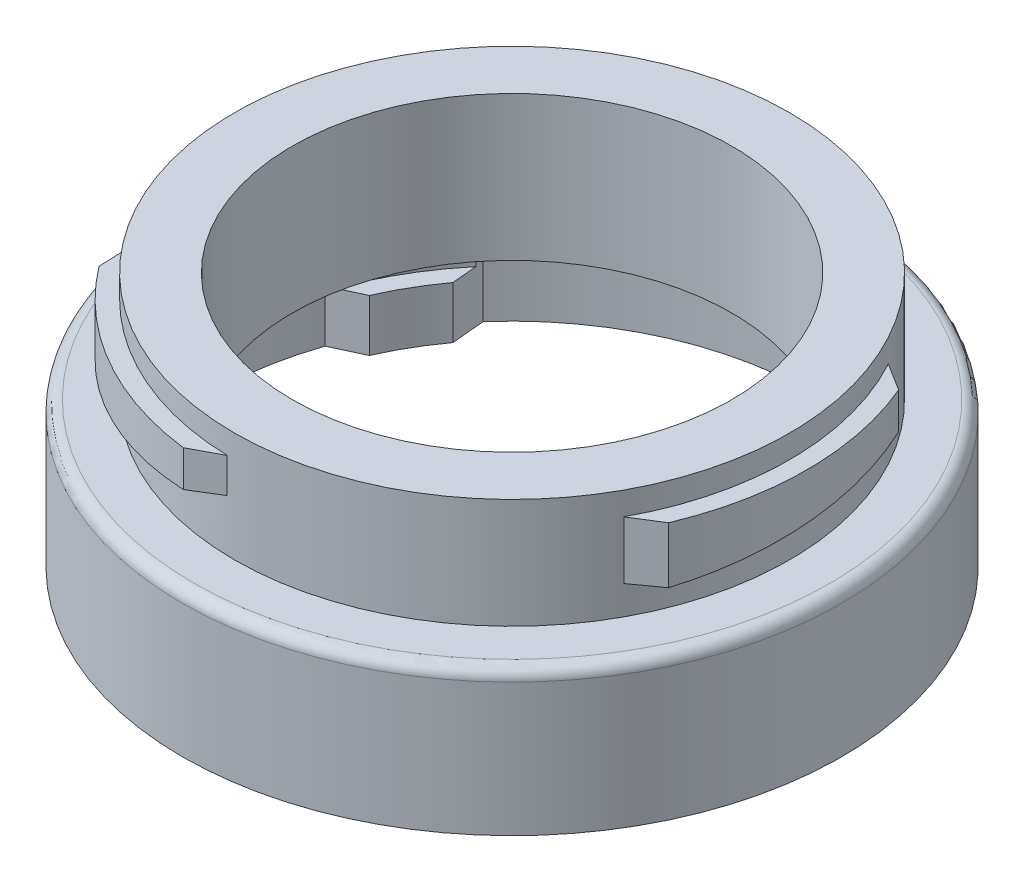
from build123d import *

# Parameters (mm, degrees)
CUT_EXTRUDE_1_DEPTH      = 5
EXTRUDE_1_DEPTH          = 6
PATTERN_CIRCULAR_1_COUNT = 3
SKETCH_4_R               = 42.404307435
SKETCH_4_R_2             = 25.5
CUT_EXTRUDE_2_DEPTH      = 9.5
CHAMFER_START            = 14
CHAMFER_1_DEPTH          = 6


with BuildPart() as part:
    # Эскиз1 → Повернуть1 (revolve)
    with BuildSketch(Plane.XY, mode=Mode.PRIVATE) as revolve_1_sk:
        with BuildLine():
            Line((-24, 0), (-24, 4.5))
            Line((-24, 4.5), (-25.5, 4.5))
            Line((-25.5, 4.5), (-25.5, 9.5))
            Line((-25.5, 9.5), (-19, 9.5))
            Line((-19, 9.5), (-19, 22))
            Line((-19, 22), (-24, 22))
            Line((-24, 22), (-24, 12.5))
            Line((-24, 12.5), (-27.5, 12.5))
            ThreePointArc((-27.5, 12.5), (-28.207106781, 12.207106781), (-28.5, 11.5))
            Line((-28.5, 11.5), (-28.5, 0))
            Line((-28.5, 0), (-24, 0))
        make_face()
    revolve(revolve_1_sk.sketch.rotate(Axis((0, 0, 0), (0, -1, 0)), 270), axis=Axis((0, 0, 0), (0, -1, 0)))

    # Эскиз2 → Вырез-Вытянуть1 (cut)
    with BuildSketch(Plane(origin=(0, 0, 0), x_dir=(-1, 0, 0), z_dir=(0, -1, 0))):
        with BuildLine():
            ThreePointArc((24, 0), (17.8818714, -16.007456864), (2.646777063, -23.85360709))
            Line((2.646777063, -23.85360709), (5, -25.514701644))
            ThreePointArc((5, -25.514701644), (20.0748599, -16.522711642), (26, 0))
            ThreePointArc((26, 0), (25.646694472, 4.271658071), (24.596379794, 8.427223803))
            Line((24.596379794, 8.427223803), (21.981218243, 9.63462737))
            ThreePointArc((21.981218243, 9.63462737), (23.489883331, 4.921928594), (24, 0))
        make_face()
        with BuildLine():
            Line((-5, -25.514701644), (-2.646777063, -23.85360709))
            ThreePointArc((-2.646777063, -23.85360709), (-20.784609691, -12), (-21.981218243, 9.63462737))
            Line((-21.981218243, 9.63462737), (-24.596379794, 8.427223803))
            ThreePointArc((-24.596379794, 8.427223803), (-22.516660498, -13), (-5, -25.514701644))
        make_face()
        with BuildLine():
            Line((-19.596379794, 17.087477841), (-19.33444118, 14.218979719))
            ThreePointArc((-19.33444118, 14.218979719), (0, 24), (19.33444118, 14.218979719))
            Line((19.33444118, 14.218979719), (19.596379794, 17.087477841))
            ThreePointArc((19.596379794, 17.087477841), (0, 26), (-19.596379794, 17.087477841))
        make_face()
    extrude(amount=-CUT_EXTRUDE_1_DEPTH, mode=Mode.SUBTRACT)

    # Эскиз3 → Бобышка-Вытянуть1 (add)
    with BuildSketch(Plane(origin=(25.5, 0, 0), x_dir=(0, 0, -1), z_dir=(1, 0, 0))):
        Polygon((-11.5, 20), (11.5, 20), (11.5, 17), (-11.5, 15), align=None)
    extrude_1 = extrude(amount=-EXTRUDE_1_DEPTH)

    # Круговой массив1: Бобышка-Вытянуть1 ×3 about axis
    pattern_circular_1_axis = Axis((0, 0, 0), (0, 1, 0))
    for i in range(1, PATTERN_CIRCULAR_1_COUNT):
        add(extrude_1.rotate(pattern_circular_1_axis, i * 360 / PATTERN_CIRCULAR_1_COUNT))

    # Эскиз4 → Вырез-Вытянуть2 (cut)
    with BuildSketch(Plane(origin=(0, 22, 0), x_dir=(1, 0, 0), z_dir=(0, 1, 0))):
        Circle(SKETCH_4_R)
        with Locations(Location((0, 0, 0), (0, 0, 270))):
            Circle(SKETCH_4_R_2, mode=Mode.SUBTRACT)
    extrude(amount=-CUT_EXTRUDE_2_DEPTH, mode=Mode.SUBTRACT)

    # Фаска1: read off the stored shape, not the designer's step
    # Фаска1 outline → Фаска1 (cut)
    with BuildSketch(Plane(origin=(0, 0, 0), x_dir=(1, 0, 0), z_dir=(0, 1, 0)).offset(CHAMFER_START)):
        with BuildLine():
            Line((-20.456443185, 12.551252218), (-20.356857991, 15.357354354))
            ThreePointArc((-20.356857991, 15.357354354), (-20.859675731, 14.667103612), (-21.33909882, 13.960403344))
            Line((-21.33909882, 13.960403344), (-20.49197936, 12.493149399))
            ThreePointArc((-20.49197936, 12.493149399), (-20.474231883, 12.522213414), (-20.456443185, 12.551252218))
        make_face()
        with BuildLine():
            ThreePointArc((-1.420514533, 25.460403344), (-2.272246462, 25.398560904), (-3.12143001, 25.308233338))
            Line((-3.12143001, 25.308233338), (-0.641481678, 23.991425578))
            ThreePointArc((-0.641481678, 23.991425578), (-0.607438987, 23.992311641), (-0.573395073, 23.993149399))
            Line((-0.573395073, 23.993149399), (-1.420514533, 25.460403344))
        make_face()
        with BuildLine():
            ThreePointArc((-20.456443185, -12.551252218), (-20.474231883, -12.522213414), (-20.49197936, -12.493149399))
            Line((-20.49197936, -12.493149399), (-21.33909882, -13.960403344))
            ThreePointArc((-21.33909882, -13.960403344), (-20.859675731, -14.667103612), (-20.356857991, -15.357354354))
            Line((-20.356857991, -15.357354354), (-20.456443185, -12.551252218))
        make_face()
        with BuildLine():
            Line((22.759613353, 11.5), (21.065374433, 11.5))
            ThreePointArc((21.065374433, 11.5), (21.08167087, 11.470098227), (21.097924862, 11.44017336))
            Line((21.097924862, 11.44017336), (23.478288, 9.950878984))
            ThreePointArc((23.478288, 9.950878984), (23.131922194, 10.731457292), (22.759613353, 11.5))
        make_face()
        with BuildLine():
            ThreePointArc((-0.573395073, -23.993149399), (-0.607438987, -23.992311641), (-0.641481678, -23.991425578))
            Line((-0.641481678, -23.991425578), (-3.12143001, -25.308233338))
            ThreePointArc((-3.12143001, -25.308233338), (-2.272246462, -25.398560904), (-1.420514533, -25.460403344))
            Line((-1.420514533, -25.460403344), (-0.573395073, -23.993149399))
        make_face()
        with BuildLine():
            ThreePointArc((22.759613353, -11.5), (23.131922194, -10.731457292), (23.478288, -9.950878984))
            Line((23.478288, -9.950878984), (21.097924862, -11.44017336))
            ThreePointArc((21.097924862, -11.44017336), (21.08167087, -11.470098227), (21.065374433, -11.5))
            Line((21.065374433, -11.5), (22.759613353, -11.5))
        make_face()
    extrude(amount=CHAMFER_1_DEPTH, mode=Mode.SUBTRACT)


solid = part.part
